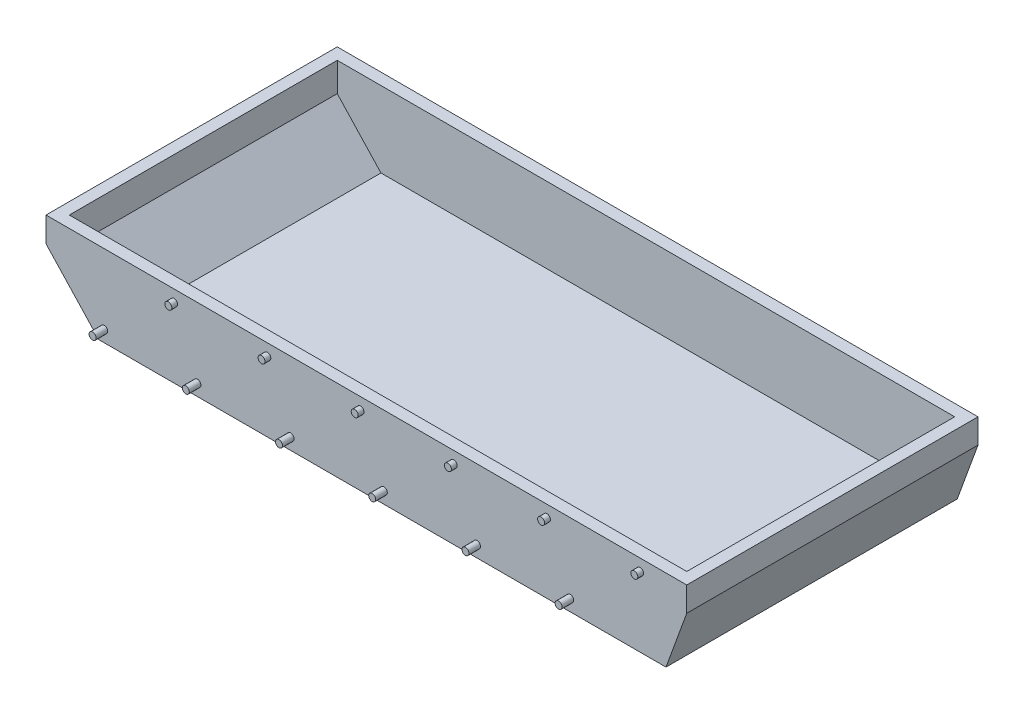
from build123d import *

# Parameters (mm, degrees)
SKETCH1_W           = 480
SKETCH1_H           = 250
BOSS_EXTRUDE1_DEPTH = 70
SKETCH2_W           = 250
SKETCH2_H           = 20
BOSS_EXTRUDE2_DEPTH = 50
CHAMFER1_SIZE       = 55
CHAMFER1_SIZE_2     = 51.288329738
SKETCH3_W           = 250
SKETCH3_H           = 20
BOSS_EXTRUDE3_DEPTH = 20
CHAMFER3_SIZE       = 56
CHAMFER3_SIZE_2     = 20.382333119
SHELL1_START        = -115
SHELL1_DEPTH        = 230
SKETCH4_R           = 3
BOSS_EXTRUDE4_DEPTH = 5
SKETCH6_R           = 3
BOSS_EXTRUDE5_DEPTH = 10


# Read off the part's stored shape, not the designer's step: Shell1
with BuildPart() as part:
    # Sketch1 → Boss-Extrude1 (new body)
    with BuildSketch(Plane(origin=(0, 0, 0), x_dir=(1, 0, 0), z_dir=(0, 1, 0))):
        Rectangle(SKETCH1_W, SKETCH1_H)
    extrude(amount=BOSS_EXTRUDE1_DEPTH)

    # Sketch2 → Boss-Extrude2 (add)
    with BuildSketch(Plane.ZY.offset(240)):
        with Locations((0, 60)):
            Rectangle(SKETCH2_W, SKETCH2_H)
    extrude(amount=BOSS_EXTRUDE2_DEPTH)

    # Chamfer1
    # the kernel refuses this chamfer: 55, 51.288329738 mm, written as the material it adds along each edge
    with BuildSketch(Plane(origin=(-240, 50, 125), x_dir=(0.02649526118620358, -0.9996489389454054, 0), z_dir=(0, 0, -1))) as chamfer1_piece_1_section:
        Polygon((CHAMFER1_SIZE * 0.999648938945, CHAMFER1_SIZE * 0.0264952611862), (-CHAMFER1_SIZE_2 * 0.026495261186, CHAMFER1_SIZE_2 * 0.999648938937), (0, 0), align=None)
    chamfer1_piece_1 = extrude(amount=250, mode=Mode.PRIVATE)
    chamfer1_piece_1 = split(chamfer1_piece_1, bisect_by=Plane(origin=(-257.002695591, 0, 0), z_dir=(0, 1, 0)), keep=Keep.TOP, mode=Mode.PRIVATE)
    chamfer1_piece_1 = split(chamfer1_piece_1, bisect_by=Plane(origin=(-290, 32.326466584, 0), z_dir=(1, 0, 0)), keep=Keep.TOP, mode=Mode.PRIVATE)
    add(chamfer1_piece_1)

    # Sketch3 → Boss-Extrude3 (add)
    with BuildSketch(Plane(origin=(240, 0, 0), x_dir=(0, 0, -1), z_dir=(1, 0, 0))):
        with Locations((0, 60)):
            Rectangle(SKETCH3_W, SKETCH3_H)
    extrude(amount=BOSS_EXTRUDE3_DEPTH)

    # Chamfer3
    # the kernel refuses this chamfer: 56, 20.382333119 mm, written as the material it adds along each edge
    with BuildSketch(Plane(origin=(240, 50, -125), x_dir=(-0.013184058198645885, -0.9999130865277316, 0), z_dir=(0, 0, 1))) as chamfer3_piece_1_section:
        Polygon((CHAMFER3_SIZE * 0.999913086528, CHAMFER3_SIZE * 0.0131840581986), (-CHAMFER3_SIZE_2 * 0.0131840581986, CHAMFER3_SIZE_2 * 0.999913086523), (0, 0), align=None)
    chamfer3_piece_1 = extrude(amount=250, mode=Mode.PRIVATE)
    chamfer3_piece_1 = split(chamfer3_piece_1, bisect_by=Plane(origin=(246.40635993, 0, 0), z_dir=(0, 1, 0)), keep=Keep.TOP, mode=Mode.PRIVATE)
    chamfer3_piece_1 = split(chamfer3_piece_1, bisect_by=Plane(origin=(260, 31.786057297, 0), z_dir=(-1, 0, 0)), keep=Keep.TOP, mode=Mode.PRIVATE)
    add(chamfer3_piece_1)

    # Shell1 outline → Shell1 (cut)
    with BuildSketch(Plane.XY.offset(SHELL1_START)):
        Polygon((-242.488513556, 5), (238.682783715, 5), (250, 36.093796195), (250, 70), (-280, 70), (-280, 45.226144329), align=None)
    extrude(amount=SHELL1_DEPTH, mode=Mode.SUBTRACT)

    # Sketch4 → Boss-Extrude4 (add)
    with BuildSketch(Plane.XY.offset(125)):
        with Locations(Location((220, 60, 0), (0, 0, 180))):
            Circle(SKETCH4_R)
        with Locations(Location((140, 60, 0), (0, 0, 180))):
            Circle(SKETCH4_R)
        with Locations(Location((60, 60, 0), (0, 0, 180))):
            Circle(SKETCH4_R)
        with Locations(Location((-20, 60, 0), (0, 0, 180))):
            Circle(SKETCH4_R)
        with Locations(Location((-100, 60, 0), (0, 0, 180))):
            Circle(SKETCH4_R)
        with Locations(Location((-180, 60, 0), (0, 0, 180))):
            Circle(SKETCH4_R)
    extrude(amount=BOSS_EXTRUDE4_DEPTH)

    # Sketch6 → Boss-Extrude5 (add)
    with BuildSketch(Plane.XY.offset(125)):
        with Locations(Location((160, 10, 0), (0, 0, 180))):
            Circle(SKETCH6_R)
        with Locations(Location((80, 10, 0), (0, 0, 180))):
            Circle(SKETCH6_R)
        with Locations(Location((0, 10, 0), (0, 0, 180))):
            Circle(SKETCH6_R)
        with Locations(Location((-80, 10, 0), (0, 0, 180))):
            Circle(SKETCH6_R)
        with Locations(Location((-160, 10, 0), (0, 0, 180))):
            Circle(SKETCH6_R)
        with Locations(Location((-240, 10, 0), (0, 0, 180))):
            Circle(SKETCH6_R)
    extrude(amount=BOSS_EXTRUDE5_DEPTH)


solid = part.part
